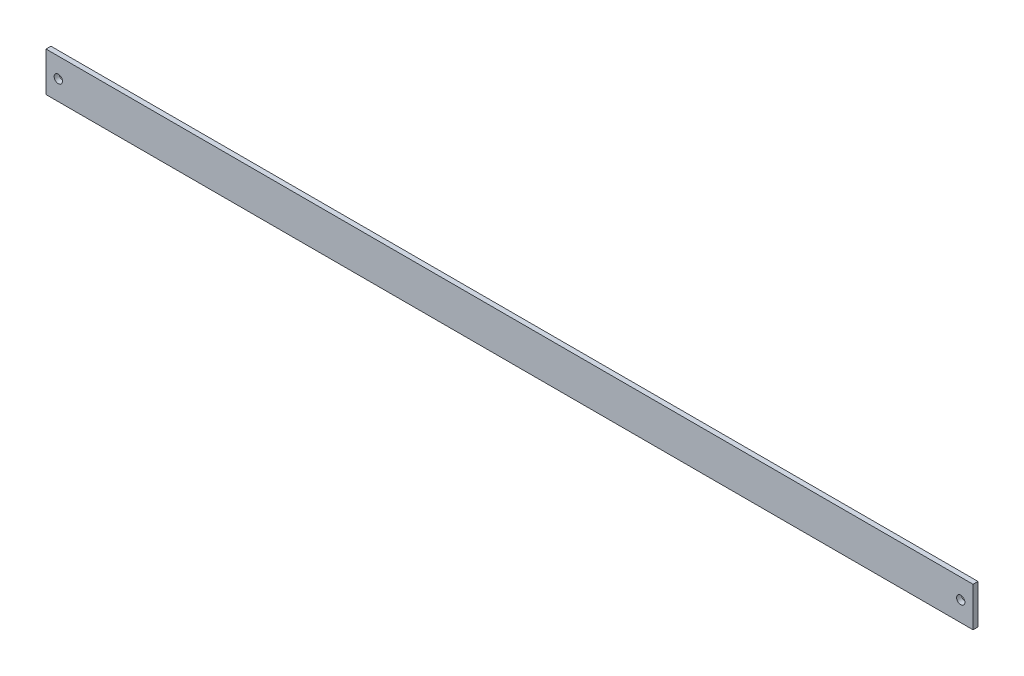
from build123d import *

# Parameters (mm, degrees)
SKETCH1_W           = 3.175
SKETCH1_H           = 25.4
BOSS_EXTRUDE1_DEPTH = 596.9
CUT_EXTRUDE1_REACH  = 599.449
SKETCH2_R           = 2.667


with BuildPart() as part:
    # Sketch1 → Boss-Extrude1 (new body)
    with BuildSketch(Plane(origin=(0, 0, 0), x_dir=(0, 0, -1), z_dir=(1, 0, 0))):
        with Locations((1.5875, 12.7)):
            Rectangle(SKETCH1_W, SKETCH1_H)
    extrude(amount=BOSS_EXTRUDE1_DEPTH)

    # Sketch2 → Cut-Extrude1 (cut, up to next)
    with BuildSketch(Plane.XY, mode=Mode.PRIVATE) as cut_extrude1_sk1:
        with Locations((7.9375, 12.7)):
            Circle(SKETCH2_R)
    cut_extrude1_tool1 = extrude(cut_extrude1_sk1.sketch, amount=-CUT_EXTRUDE1_REACH, mode=Mode.PRIVATE) & part.part
    # Sketch2 → Cut-Extrude1 (cut, up to next)
    with BuildSketch(Plane.XY, mode=Mode.PRIVATE) as cut_extrude1_sk2:
        with Locations((588.9625, 12.7)):
            Circle(SKETCH2_R)
    cut_extrude1_tool2 = extrude(cut_extrude1_sk2.sketch, amount=-CUT_EXTRUDE1_REACH, mode=Mode.PRIVATE) & part.part
    add(cut_extrude1_tool1.solids().sort_by_distance((7.9375, 12.7, 0))[0], mode=Mode.SUBTRACT)
    add(cut_extrude1_tool2.solids().sort_by_distance((588.9625, 12.7, 0))[0], mode=Mode.SUBTRACT)


solid = part.part
